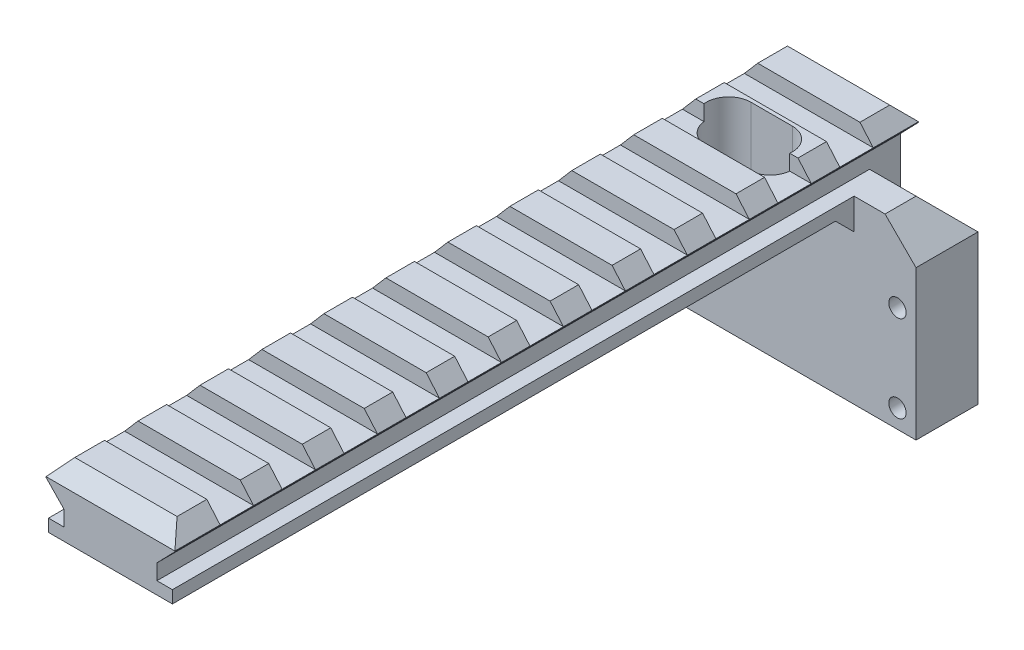
from build123d import *

# Parameters (mm, degrees)
EXTRUDE_1_DEPTH        = 20
SKETCH_2_R             = 1.4
CUT_EXTRUDE_1_DEPTH    = 40
SKETCH_1_3_W           = 110
SKETCH_1_3_H           = 2
EXTRUDE_2_DEPTH        = 10
EXTRUDE_3_DEPTH        = 120
CUT_EXTRUDE_2_DEPTH    = 20
SKETCH_5_W             = 25
SKETCH_5_H             = 5.4
CUT_EXTRUDE_3_DEPTH    = 2.5
PATTERN_LINEAR_1_COUNT = 11
PATTERN_LINEAR_1_PITCH = 10
CHAMFER_1_SIZE         = 3
SKETCH_6_R             = 2.9
CUT_EXTRUDE_4_DEPTH    = 2
CHAMFER_2_SIZE         = 1.6
CHAMFER_2_SIZE_2       = 2
CHAMFER_3_SIZE         = 2.5
CHAMFER_4_SIZE         = 5


with BuildPart() as part:
    # 스케치1 → 보스-돌출1 (new, symmetric)
    with BuildSketch(Plane(origin=(0, 0, 0), x_dir=(0, 0, -1), z_dir=(1, 0, 0))):
        Polygon((-10, 29.1), (-10, 27.1), (-10, 0), (0, 0), (0, 29.1), align=None)
    extrude(amount=EXTRUDE_1_DEPTH, both=True)

    # 스케치2 → 컷-돌출1 (cut)
    with BuildSketch(Plane.XY):
        with Locations((17, 3)):
            Circle(SKETCH_2_R)
        with Locations((17, 17)):
            Circle(SKETCH_2_R)
        with Locations(Location((-17, 3, 0), (0, 0, 180))):
            Circle(SKETCH_2_R)
        with Locations(Location((-17, 17, 0), (0, 0, 180))):
            Circle(SKETCH_2_R)
    extrude(amount=CUT_EXTRUDE_1_DEPTH, mode=Mode.SUBTRACT)

    # 스케치1<3> → 보스-돌출2 (add, symmetric)
    with BuildSketch(Plane(origin=(0, 0, 0), x_dir=(0, 0, -1), z_dir=(1, 0, 0))):
        with Locations((-65, 28.1)):
            Rectangle(SKETCH_1_3_W, SKETCH_1_3_H)
    extrude(amount=EXTRUDE_2_DEPTH, both=True)

    # 스케치3 → 보스-돌출3 (add)
    with BuildSketch(Plane.XY):
        Polygon((7.5, 29.1), (-7.5, 29.1), (-7.5, 31.6), (-10.4, 34.6), (-10.4, 34.7), (-8.25, 37.2), (8.25, 37.2), (10.4, 34.7), (10.4, 34.6), (7.5, 31.6), align=None)
    extrude(amount=EXTRUDE_3_DEPTH)

    # 스케치4 → 컷-돌출2 (cut)
    with BuildSketch(Plane(origin=(0, 37.2, 0), x_dir=(1, 0, 0), z_dir=(0, 1, 0))):
        with BuildLine():
            Line((-3.343759528, -13.296813629), (3.343759528, -13.296813629))
            ThreePointArc((3.343759528, -13.296813629), (6.943759528, -16.896813629), (3.343759528, -20.496813629))
            Line((3.343759528, -20.496813629), (-3.343759528, -20.496813629))
            ThreePointArc((-3.343759528, -20.496813629), (-6.943759528, -16.896813629), (-3.343759528, -13.296813629))
        make_face()
    extrude(amount=-CUT_EXTRUDE_2_DEPTH, mode=Mode.SUBTRACT)

    # 스케치5 → 컷-돌출3 (cut)
    with BuildSketch(Plane(origin=(0, 37.2, 0), x_dir=(1, 0, 0), z_dir=(0, 1, 0))):
        with Locations((0, -10)):
            Rectangle(SKETCH_5_W, SKETCH_5_H)
    cut_extrude_3 = extrude(amount=-CUT_EXTRUDE_3_DEPTH, mode=Mode.SUBTRACT)

    # 선형 패턴1: 컷-돌출3 ×11
    with Locations(*[(0, 0, i * PATTERN_LINEAR_1_PITCH) for i in range(1, PATTERN_LINEAR_1_COUNT)]):
        add(cut_extrude_3, mode=Mode.SUBTRACT)

    # 모따기1
    chamfer_1_edges = [part.edges().sort_by_distance(p)[0] for p in [
        (0, 27.1, 10),
    ]]
    chamfer(chamfer_1_edges, length=CHAMFER_1_SIZE)

    # 스케치6 → 컷-돌출4 (cut)
    with BuildSketch(Plane(origin=(0, 0, 0), x_dir=(-1, 0, 0), z_dir=(0, 0, -1))):
        with Locations((-17, 3)):
            Circle(SKETCH_6_R)
        with Locations((-17, 17)):
            Circle(SKETCH_6_R)
        with Locations((17, 17)):
            Circle(SKETCH_6_R)
        with Locations((17, 3)):
            Circle(SKETCH_6_R)
    extrude(amount=-CUT_EXTRUDE_4_DEPTH, mode=Mode.SUBTRACT)

    # 모따기2
    # the kernel refuses this chamfer: 2, 1.6 mm, written as the material it adds along each edge
    with BuildSketch(Plane(origin=(17, 3, 2), x_dir=(-1, 0, 0), z_dir=(0, -1, 0))) as chamfer_2_piece_1_section:
        Polygon((2.9 - CHAMFER_2_SIZE, 0), (2.9, CHAMFER_2_SIZE_2), (2.9, 0), align=None)
    chamfer_2_piece_1 = revolve(axis=Axis((17, 3, 2), (0, 0, -1)), mode=Mode.PRIVATE)
    chamfer_2_piece_1 = chamfer_2_piece_1 - Plane(origin=(17, 3, 0.956092246), x_dir=(1, 0, 0), z_dir=(0, 0, -1)) * Cylinder(1.4, 12, mode=Mode.PRIVATE)
    chamfer_2_piece_1 = split(chamfer_2_piece_1, bisect_by=Plane(origin=(19.173240308, 3, 0), z_dir=(0, 0, 1)), keep=Keep.TOP, mode=Mode.PRIVATE)
    add(chamfer_2_piece_1)
    with BuildSketch(Plane(origin=(-17, 3, 2), x_dir=(-1, 0, 0), z_dir=(0, -1, 0))) as chamfer_2_piece_2_section:
        Polygon((2.9 - CHAMFER_2_SIZE, 0), (2.9, CHAMFER_2_SIZE_2), (2.9, 0), align=None)
    chamfer_2_piece_2 = revolve(axis=Axis((-17, 3, 2), (0, 0, -1)), mode=Mode.PRIVATE)
    chamfer_2_piece_2 = chamfer_2_piece_2 - Plane(origin=(-17, 3, 0.956092246), x_dir=(-1, 0, 0), z_dir=(0, 0, -1)) * Cylinder(1.4, 12, mode=Mode.PRIVATE)
    chamfer_2_piece_2 = split(chamfer_2_piece_2, bisect_by=Plane(origin=(-14.826759692, 3, 0), z_dir=(0, 0, 1)), keep=Keep.TOP, mode=Mode.PRIVATE)
    add(chamfer_2_piece_2)
    with BuildSketch(Plane(origin=(-17, 17, 2), x_dir=(-1, 0, 0), z_dir=(0, -1, 0))) as chamfer_2_piece_3_section:
        Polygon((2.9 - CHAMFER_2_SIZE, 0), (2.9, CHAMFER_2_SIZE_2), (2.9, 0), align=None)
    chamfer_2_piece_3 = revolve(axis=Axis((-17, 17, 2), (0, 0, -1)), mode=Mode.PRIVATE)
    chamfer_2_piece_3 = chamfer_2_piece_3 - Plane(origin=(-17, 17, 0.956092246), x_dir=(-1, 0, 0), z_dir=(0, 0, -1)) * Cylinder(1.4, 12, mode=Mode.PRIVATE)
    chamfer_2_piece_3 = split(chamfer_2_piece_3, bisect_by=Plane(origin=(-14.826759692, 17, 0), z_dir=(0, 0, 1)), keep=Keep.TOP, mode=Mode.PRIVATE)
    add(chamfer_2_piece_3)
    with BuildSketch(Plane(origin=(17, 17, 2), x_dir=(-1, 0, 0), z_dir=(0, -1, 0))) as chamfer_2_piece_4_section:
        Polygon((2.9 - CHAMFER_2_SIZE, 0), (2.9, CHAMFER_2_SIZE_2), (2.9, 0), align=None)
    chamfer_2_piece_4 = revolve(axis=Axis((17, 17, 2), (0, 0, -1)), mode=Mode.PRIVATE)
    chamfer_2_piece_4 = chamfer_2_piece_4 - Plane(origin=(17, 17, 0.956092246), x_dir=(1, 0, 0), z_dir=(0, 0, -1)) * Cylinder(1.4, 12, mode=Mode.PRIVATE)
    chamfer_2_piece_4 = split(chamfer_2_piece_4, bisect_by=Plane(origin=(19.173240308, 17, 0), z_dir=(0, 0, 1)), keep=Keep.TOP, mode=Mode.PRIVATE)
    add(chamfer_2_piece_4)

    # 모따기3
    chamfer_3_edges = [part.edges().sort_by_distance(p)[0] for p in [
        (0, 37.2, 120),
        (0, 37.2, 0),
    ]]
    chamfer(chamfer_3_edges, length=CHAMFER_3_SIZE)

    # 모따기4
    chamfer_4_edges = [part.edges().sort_by_distance(p)[0] for p in [
        (-13.75, 29.1, 0),
        (-20, 29.1, 5),
        (20, 29.1, 5),
        (13.75, 29.1, 0),
    ]]
    chamfer(chamfer_4_edges, length=CHAMFER_4_SIZE)


solid = part.part
